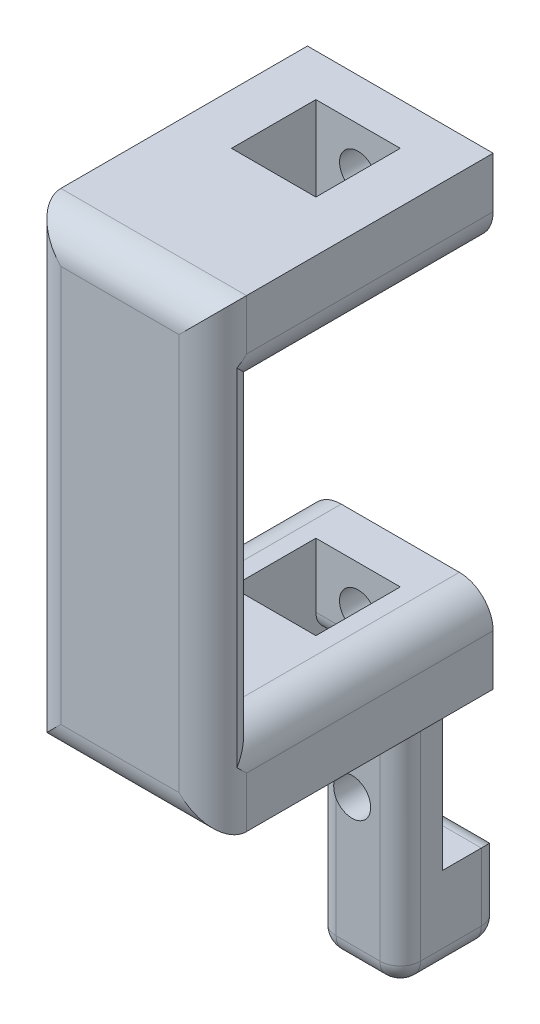
from build123d import *

# Parameters (mm, degrees)
SZKIC1_R                      = 1.100000000000001
DODANIE_WYCI_GNI_CIE1_DEPTH   = 2.5
SZKIC1_W                      = 10.999999999999996
SZKIC1_H                      = 5.000000000000001
SZKIC1_R_2                    = 1.1000003399999918
DODANIE_WYCI_GNI_CIE1_2_DEPTH = 2.5
SKETCH1_W                     = 2.9999999999999964
SKETCH1_H                     = 5
SKETCH1_W_2                   = 2.999999999999993
SKETCH1_H_2                   = 5.000000000000001
SKETCH1_W_3                   = 3
SKETCH1_H_3                   = 5.0000000000000036
BOSS_EXTRUDE1_DEPTH           = 5
SKETCH2_W                     = 11.000000000000002
SKETCH2_H                     = 5.0000000000000036
SKETCH2_W_2                   = 10.999999999999996
SKETCH2_H_2                   = 5.000000000000001
BOSS_EXTRUDE2_DEPTH           = 6.11
SKETCH3_W                     = 11
SKETCH3_H                     = 27.5
BOSS_EXTRUDE3_DEPTH           = 3
FILLET1_R                     = 2
FILLET4_R                     = 2
SKETCH4_W                     = 5.000000000000005
SKETCH4_H                     = 2.5000000000000284
BOSS_EXTRUDE4_DEPTH           = 16
SKETCH5_W                     = 5.000000000000005
SKETCH5_H                     = 5.204234406731111
BOSS_EXTRUDE5_DEPTH           = 3.5
CUT_EXTRUDE1_REACH            = 48.124
SKETCH6_R                     = 1.100000000000001
FILLET5_R                     = 1.2
FILLET6_R                     = 1.2
FILLET7_R                     = 1.2


# Some blends are built 0.0001 mm under size
with BuildPart() as part:
    # Szkic1 → Dodanie-wyciągnięcie1 (new body)
    with BuildSketch(Plane.XY.offset(158.8328846419772)):
        Polygon((-19.268421222013334, -17.474256580110417), (-8.268421222013332, -17.474256580110413), (-8.268421222013332, -22.474256580110417), (-19.268421222013334, -22.474256580110417), align=None)
        with Locations((-13.768421222013336, -19.974256580110417)):
            Circle(SZKIC1_R, mode=Mode.SUBTRACT)
    extrude(amount=DODANIE_WYCI_GNI_CIE1_DEPTH)



with BuildPart() as body_2:
    # Szkic1 → Dodanie-wyci_gni_cie1 2 (new body)
    with BuildSketch(Plane.XY.offset(158.8328846419772)):
        with Locations((-13.768421222013332, 2.5257434198895825)):
            Rectangle(SZKIC1_W, SZKIC1_H)
        with Locations((-13.768421222013332, 2.5257434198895856)):
            Circle(SZKIC1_R_2, mode=Mode.SUBTRACT)
    extrude(amount=DODANIE_WYCI_GNI_CIE1_2_DEPTH)


with BuildPart() as part_1:
    add(part.part)

    add(body_2.part)  # Boss-Extrude1 merges body 2
    # Sketch1 → Boss-Extrude1 (add)
    with BuildSketch(Plane.XY.offset(161.33288464197722)):
        with Locations((-17.768421222013338, -19.974256580110417)):
            Rectangle(SKETCH1_W, SKETCH1_H)
        with Locations((-17.768421222013334, 2.5257434198895825)):
            Rectangle(SKETCH1_W_2, SKETCH1_H_2)
        with Locations((-9.768421222013334, 2.5257434198895825)):
            Rectangle(SKETCH1_W_3, SKETCH1_H_2)
        with Locations((-9.768421222013332, -19.974256580110413)):
            Rectangle(SKETCH1_W_3, SKETCH1_H_3)
    extrude(amount=BOSS_EXTRUDE1_DEPTH)

    # Sketch2 → Boss-Extrude2 (add)
    with BuildSketch(Plane.XY.offset(166.33288464197722)):
        with Locations((-13.768421222013334, -19.974256580110413)):
            Rectangle(SKETCH2_W, SKETCH2_H)
        with Locations((-13.768421222013332, 2.5257434198895825)):
            Rectangle(SKETCH2_W_2, SKETCH2_H_2)
    extrude(amount=BOSS_EXTRUDE2_DEPTH)

    # Sketch3 → Boss-Extrude3 (add)
    with BuildSketch(Plane.XY.offset(172.4428846419772)):
        with Locations((-13.768421222013334, -8.724256580110417)):
            Rectangle(SKETCH3_W, SKETCH3_H)
    extrude(amount=BOSS_EXTRUDE3_DEPTH)

    # Fillet1
    fillet1_edges = [part_1.edges().sort_by_distance(p)[0] for p in [
        (-19.268421222013334, -8.724256580110417, 175.4428846419772),
        (-13.768421222013334, -22.474256580110417, 175.4428846419772),
        (-8.268421222013334, -8.724256580110417, 175.4428846419772),
        (-13.768421222013334, 5.025743419889583, 175.4428846419772),
    ]]
    fillet(fillet1_edges, radius=FILLET1_R)

    # Fillet4
    # the kernel refuses this fillet: 2 mm, written as the material it takes off along each edge
    with BuildSketch(Plane(origin=(-8.268421222013334, -17.474256580110413, 172.4428846419772), x_dir=(0, 0, 1), z_dir=(0, 1, 0))) as fillet4_piece_1:
        with BuildLine():
            CenterArc((FILLET4_R, -FILLET4_R), FILLET4_R, 90, 90)
            Line((0, -FILLET4_R), (0, 0))
            Line((0, 0), (FILLET4_R, 0))
        make_face()
    extrude(amount=17.499999999999996, mode=Mode.SUBTRACT)
    with BuildSketch(Plane(origin=(-19.268421222013334, 0.02574341988958206, 172.4428846419772), x_dir=(1.78e-15, 0, 1), z_dir=(0, -1, 0))) as fillet4_piece_2:
        with BuildLine():
            CenterArc((FILLET4_R, -FILLET4_R), FILLET4_R, 90.0000000000001, 89.9999999999999)
            Line((3.55e-15, -FILLET4_R), (0, 0))
            Line((0, 0), (FILLET4_R, 0))
        make_face()
    extrude(amount=17.499999999999996, mode=Mode.SUBTRACT)
    with BuildSketch(Plane(origin=(-8.268421222013334, 0.02574341988958231, 153.8328846419772), x_dir=(0, 1, 0), z_dir=(0, 0, 1)), Plane(origin=(-19.26842122201333, 0.02574341988958231, 172.44288464197723), x_dir=(0, 1, 0), z_dir=(0, 0, -1))) as fillet4_piece_3:
        with BuildLine():
            CenterArc((FILLET4_R, FILLET4_R), FILLET4_R, 180, 90)
            Line((-2.5e-16, FILLET4_R), (0, 0))
            Line((0, 0), (FILLET4_R, 0))
        make_face()
    extrude(amount=18.610000000000042, mode=Mode.SUBTRACT)
    with BuildSketch(Plane(origin=(-19.26842122201333, -17.474256580110417, 153.8328846419772), x_dir=(0, -1, 2.6e-16), z_dir=(0, 2.6e-16, 1))) as fillet4_piece_4:
        with BuildLine():
            CenterArc((FILLET4_R, FILLET4_R), FILLET4_R, 180, 90)
            Line((0, FILLET4_R), (0, 0))
            Line((0, 0), (FILLET4_R, 0))
        make_face()
    extrude(amount=18.610000000000042, mode=Mode.SUBTRACT)
    with BuildSketch(Plane(origin=(-8.268421222013332, -17.474256580110413, 172.44288464197723), x_dir=(-8.9e-16, -1, 0), z_dir=(0, 0, -1))) as fillet4_piece_5:
        with BuildLine():
            CenterArc((FILLET4_R, FILLET4_R), FILLET4_R, 180, 89.99999999999994)
            Line((1.78e-15, FILLET4_R), (0, 0))
            Line((0, 0), (FILLET4_R, 0))
        make_face()
    extrude(amount=18.610000000000042, mode=Mode.SUBTRACT)
    with BuildSketch(Plane(origin=(-8.268421222013334, -17.474256580110413, 177.44288464197723), x_dir=(0, -1, 0), z_dir=(0, 0, -1))) as fillet4_piece_6a_section:
        with BuildLine():
            CenterArc((FILLET4_R, FILLET4_R), FILLET4_R, 180.00000000000006, 89.99999999999994)
            Line((0, FILLET4_R), (0, 0))
            Line((0, 0), (FILLET4_R, 0))
        make_face()
    fillet4_piece_6a = extrude(amount=23.610000000000042, mode=Mode.PRIVATE)
    fillet4_piece_6a = split(fillet4_piece_6a, bisect_by=Plane(origin=(-8.721211450546983, -17.92704680864406, 172.4428846419772), z_dir=(0, 0, 1)), keep=Keep.TOP, mode=Mode.PRIVATE)
    with BuildSketch(Plane(origin=(-8.268421222013334, -22.474256580110413, 172.4428846419772), x_dir=(0, 0, 1), z_dir=(0, 1, 0))) as fillet4_piece_6b_section:
        with BuildLine():
            CenterArc((FILLET4_R, -FILLET4_R), FILLET4_R, 90, 90)
            Line((0, -FILLET4_R), (0, 0))
            Line((0, 0), (FILLET4_R, 0))
        make_face()
    fillet4_piece_6b = extrude(amount=22.499999999999996, mode=Mode.PRIVATE)
    fillet4_piece_6b = split(fillet4_piece_6b, bisect_by=Plane(origin=(-8.721211450546978, -17.474256580110413, 172.89567487051085), z_dir=(3.2e-16, -1, 0)), keep=Keep.TOP, mode=Mode.PRIVATE)
    fillet4_piece_6 = fillet4_piece_6a & fillet4_piece_6b
    add(fillet4_piece_6, mode=Mode.SUBTRACT)
    with BuildSketch(Plane(origin=(-8.268421222013334, -17.474256580110413, 172.4428846419772), x_dir=(0, 0, 1), z_dir=(0, 1, 0))) as fillet4_piece_7a_section:
        with BuildLine():
            CenterArc((FILLET4_R, -FILLET4_R), FILLET4_R, 90, 90)
            Line((0, -FILLET4_R), (0, 0))
            Line((0, 0), (FILLET4_R, 0))
        make_face()
    fillet4_piece_7a = extrude(amount=22.499999999999996, mode=Mode.PRIVATE)
    fillet4_piece_7a = split(fillet4_piece_7a, bisect_by=Plane(origin=(-8.721211450546976, 0.02574341988958231, 172.89567487051085), z_dir=(0, 1, 0)), keep=Keep.TOP, mode=Mode.PRIVATE)
    with BuildSketch(Plane(origin=(-8.268421222013334, 0.02574341988958231, 153.8328846419772), x_dir=(0, 1, 0), z_dir=(0, 0, 1))) as fillet4_piece_7b_section:
        with BuildLine():
            CenterArc((FILLET4_R, FILLET4_R), FILLET4_R, 180, 90)
            Line((-2.5e-16, FILLET4_R), (0, 0))
            Line((0, 0), (FILLET4_R, 0))
        make_face()
    fillet4_piece_7b = extrude(amount=23.610000000000042, mode=Mode.PRIVATE)
    fillet4_piece_7b = split(fillet4_piece_7b, bisect_by=Plane(origin=(-8.721211450546985, 0.4785336484232321, 172.4428846419772), z_dir=(0, 0, 1)), keep=Keep.TOP, mode=Mode.PRIVATE)
    fillet4_piece_7 = fillet4_piece_7a & fillet4_piece_7b
    add(fillet4_piece_7, mode=Mode.SUBTRACT)
    with BuildSketch(Plane(origin=(-19.26842122201333, 0.02574341988958206, 177.44288464197723), x_dir=(0, 1, 0), z_dir=(0, 0, -1))) as fillet4_piece_8a_section:
        with BuildLine():
            CenterArc((FILLET4_R, FILLET4_R), FILLET4_R, 180, 90)
            Line((0, FILLET4_R), (0, 0))
            Line((0, 0), (FILLET4_R, 0))
        make_face()
    fillet4_piece_8a = extrude(amount=23.610000000000042, mode=Mode.PRIVATE)
    fillet4_piece_8a = split(fillet4_piece_8a, bisect_by=Plane(origin=(-18.81563099347968, 0.4785336484232321, 172.4428846419772), z_dir=(0, 0, 1)), keep=Keep.TOP, mode=Mode.PRIVATE)
    with BuildSketch(Plane(origin=(-19.26842122201333, 5.025743419889582, 172.4428846419772), x_dir=(0, 0, 1), z_dir=(0, -1, 0))) as fillet4_piece_8b_section:
        with BuildLine():
            CenterArc((FILLET4_R, -FILLET4_R), FILLET4_R, 90, 90)
            Line((0, -FILLET4_R), (0, 0))
            Line((0, 0), (FILLET4_R, 0))
        make_face()
    fillet4_piece_8b = extrude(amount=22.499999999999996, mode=Mode.PRIVATE)
    fillet4_piece_8b = split(fillet4_piece_8b, bisect_by=Plane(origin=(-18.815630993479687, 0.02574341988958231, 172.89567487051087), z_dir=(0, 1, 0)), keep=Keep.TOP, mode=Mode.PRIVATE)
    fillet4_piece_8 = fillet4_piece_8a & fillet4_piece_8b
    add(fillet4_piece_8, mode=Mode.SUBTRACT)
    with BuildSketch(Plane(origin=(-19.268421222013334, 0.02574341988958206, 172.4428846419772), x_dir=(1.78e-15, 0, 1), z_dir=(0, -1, 0))) as fillet4_piece_9a_section:
        with BuildLine():
            CenterArc((FILLET4_R, -FILLET4_R), FILLET4_R, 90.0000000000001, 89.9999999999999)
            Line((3.55e-15, -FILLET4_R), (0, 0))
            Line((0, 0), (FILLET4_R, 0))
        make_face()
    fillet4_piece_9a = extrude(amount=22.499999999999996, mode=Mode.PRIVATE)
    fillet4_piece_9a = split(fillet4_piece_9a, bisect_by=Plane(origin=(-18.815630993479687, -17.474256580110417, 172.89567487051082), z_dir=(3.2e-16, -1, 0)), keep=Keep.TOP, mode=Mode.PRIVATE)
    with BuildSketch(Plane(origin=(-19.26842122201333, -17.474256580110417, 153.8328846419772), x_dir=(0, -1, 2.6e-16), z_dir=(0, 2.6e-16, 1))) as fillet4_piece_9b_section:
        with BuildLine():
            CenterArc((FILLET4_R, FILLET4_R), FILLET4_R, 180, 90)
            Line((0, FILLET4_R), (0, 0))
            Line((0, 0), (FILLET4_R, 0))
        make_face()
    fillet4_piece_9b = extrude(amount=23.610000000000042, mode=Mode.PRIVATE)
    fillet4_piece_9b = split(fillet4_piece_9b, bisect_by=Plane(origin=(-18.815630993479676, -17.927046808644057, 172.4428846419772), z_dir=(0, 0, 1)), keep=Keep.TOP, mode=Mode.PRIVATE)
    fillet4_piece_9 = fillet4_piece_9a & fillet4_piece_9b
    add(fillet4_piece_9, mode=Mode.SUBTRACT)

    # Sketch4 → Boss-Extrude4 (add)
    with BuildSketch(Plane.XZ.offset(22.474256580110417)):
        with Locations((-13.768421222013334, 160.08288464197722)):
            Rectangle(SKETCH4_W, SKETCH4_H)
    extrude(amount=BOSS_EXTRUDE4_DEPTH)

    # Sketch5 → Boss-Extrude5 (add)
    with BuildSketch(Plane(origin=(0, 0, 158.8328846419772), x_dir=(-1, 0, 0), z_dir=(0, 0, -1))):
        with Locations((13.768421222013334, -35.872139376744855)):
            Rectangle(SKETCH5_W, SKETCH5_H)
    extrude(amount=BOSS_EXTRUDE5_DEPTH)

    # Sketch6 → Cut-Extrude1 (cut, up to next)
    with BuildSketch(Plane(origin=(0, 0, 158.8328846419772), x_dir=(-1, 0, 0), z_dir=(0, 0, -1)), mode=Mode.PRIVATE) as cut_extrude1_sk1:
        with Locations((14.12355315691837, -29.672298155784087)):
            Circle(SKETCH6_R)
    cut_extrude1_tool1 = extrude(cut_extrude1_sk1.sketch, amount=-CUT_EXTRUDE1_REACH, mode=Mode.PRIVATE) & part_1.part
    add(cut_extrude1_tool1.solids().sort_by_distance((-14.123553, -29.672298, 158.832885))[0], mode=Mode.SUBTRACT)

    # Fillet5
    fillet5_edges = [part_1.edges().sort_by_distance(p)[0] for p in [
        (-11.268421222013332, -35.872139376744855, 155.3328846419772),
        (-13.768421222013334, -38.47425658011041, 155.3328846419772),
        (-16.268421222013338, -35.872139376744855, 155.3328846419772),
        (-13.768421222013334, -33.2700221733793, 155.3328846419772),
    ]]
    fillet(fillet5_edges, radius=FILLET5_R)

    # Fillet6
    # the kernel refuses this fillet: 1.2 mm, written as the material it takes off along each edge
    with BuildSketch(Plane(origin=(-12.468421222013331, -37.27425658011042, 156.53288464197718), x_dir=(1, 0, 0), z_dir=(0, -1, 0))) as fillet6_piece_1_section:
        Polygon((0, 0), (FILLET6_R * 1.02, 0), (FILLET6_R * 1.02, -FILLET6_R * 1.02), (0, -FILLET6_R * 1.02), align=None)
    fillet6_piece_1 = extrude(amount=FILLET6_R * 1.02, mode=Mode.PRIVATE)
    fillet6_piece_1 = fillet6_piece_1 - Plane(origin=(-12.468421222013331, -37.27425658011042, 156.53288464197718), x_dir=(-0.7071067811865475, 0, 0.7071067811865475), z_dir=(0, -1, 0)) * Sphere(FILLET6_R, mode=Mode.PRIVATE)
    add(fillet6_piece_1, mode=Mode.SUBTRACT)
    with BuildSketch(Plane(origin=(-15.068421222013338, -37.27425658011042, 156.53288464197718), x_dir=(0, -1, 0), z_dir=(-1, 0, 0))) as fillet6_piece_2_section:
        Polygon((0, 0), (FILLET6_R * 1.02, 0), (FILLET6_R * 1.02, -FILLET6_R * 1.02), (0, -FILLET6_R * 1.02), align=None)
    fillet6_piece_2 = extrude(amount=FILLET6_R * 1.02, mode=Mode.PRIVATE)
    fillet6_piece_2 = fillet6_piece_2 - Plane(origin=(-15.068421222013338, -37.27425658011042, 156.53288464197718), x_dir=(0, 0.7071067811865475, 0.7071067811865475), z_dir=(-1, 0, 0)) * Sphere(FILLET6_R, mode=Mode.PRIVATE)
    add(fillet6_piece_2, mode=Mode.SUBTRACT)
    with BuildSketch(Plane(origin=(-12.468421222013331, -37.27425658011042, 160.13288464197723), x_dir=(0, -1, 0), z_dir=(1, 0, 0))) as fillet6_piece_3_section:
        Polygon((0, 0), (FILLET6_R * 1.02, 0), (FILLET6_R * 1.02, -FILLET6_R * 1.02), (0, -FILLET6_R * 1.02), align=None)
    fillet6_piece_3 = extrude(amount=FILLET6_R * 1.02, mode=Mode.PRIVATE)
    fillet6_piece_3 = fillet6_piece_3 - Plane(origin=(-12.468421222013331, -37.27425658011042, 160.13288464197723), x_dir=(0, 0.7071067811865475, -0.7071067811865475), z_dir=(1, 0, 0)) * Sphere(FILLET6_R, mode=Mode.PRIVATE)
    add(fillet6_piece_3, mode=Mode.SUBTRACT)
    with BuildSketch(Plane(origin=(-15.068421222013338, -37.27425658011042, 160.13288464197723), x_dir=(0, -1, 0), z_dir=(-1, 0, 0))) as fillet6_piece_4_section:
        Polygon((0, 0), (FILLET6_R * 1.02, 0), (FILLET6_R * 1.02, FILLET6_R * 1.02), (0, FILLET6_R * 1.02), align=None)
    fillet6_piece_4 = extrude(amount=FILLET6_R * 1.02, mode=Mode.PRIVATE)
    fillet6_piece_4 = fillet6_piece_4 - Plane(origin=(-15.068421222013338, -37.27425658011042, 160.13288464197723), x_dir=(0, 0.7071067811865475, -0.7071067811865475), z_dir=(-1, 0, 0)) * Sphere(FILLET6_R, mode=Mode.PRIVATE)
    add(fillet6_piece_4, mode=Mode.SUBTRACT)
    with BuildSketch(Plane(origin=(-11.268421222013332, -22.474256580110417, 161.33288464197722), x_dir=(-1, 0, -2.368e-14), z_dir=(0, -1, 0))) as fillet6_piece_5:
        with BuildLine():
            CenterArc((FILLET6_R, FILLET6_R), FILLET6_R, 180, 89.99999999999864)
            Line((2.842e-14, FILLET6_R), (0, 0))
            Line((0, 0), (FILLET6_R, 0))
        make_face()
    extrude(amount=14.8, mode=Mode.SUBTRACT)
    with BuildSketch(Plane(origin=(-16.268421222013338, -22.474256580110417, 161.33288464197722), x_dir=(0, 0, -1), z_dir=(0, -1, 0))) as fillet6_piece_6:
        with BuildLine():
            CenterArc((FILLET6_R, FILLET6_R), FILLET6_R, 180, 90)
            Line((0, FILLET6_R), (0, 0))
            Line((0, 0), (FILLET6_R, 0))
        make_face()
    extrude(amount=14.8, mode=Mode.SUBTRACT)
    with BuildSketch(Plane(origin=(-12.468421222013331, -38.47425658011042, 161.33288464197722), x_dir=(0, 0, -1), z_dir=(-1, 0, 0))) as fillet6_piece_7:
        with BuildLine():
            CenterArc((FILLET6_R, -FILLET6_R), FILLET6_R, 90, 90)
            Line((0, -FILLET6_R), (0, 0))
            Line((0, 0), (FILLET6_R, 0))
        make_face()
    extrude(amount=2.6000000000000068, mode=Mode.SUBTRACT)
    with BuildSketch(Plane(origin=(-16.268421222013338, -38.47425658011041, 156.53288464197718), x_dir=(0, 1, 1.18e-15), z_dir=(0, -1.18e-15, 1))) as fillet6_piece_8:
        with BuildLine():
            CenterArc((FILLET6_R, -FILLET6_R), FILLET6_R, 90, 90)
            Line((0, -FILLET6_R), (0, 0))
            Line((0, 0), (FILLET6_R, 0))
        make_face()
    extrude(amount=3.600000000000051, mode=Mode.SUBTRACT)
    with BuildSketch(Plane(origin=(-11.268421222013332, -38.47425658011042, 160.13288464197723), x_dir=(-1, 0, 0), z_dir=(0, 1.18e-15, -1))) as fillet6_piece_9:
        with BuildLine():
            CenterArc((FILLET6_R, FILLET6_R), FILLET6_R, 180, 90)
            Line((0, FILLET6_R), (0, 0))
            Line((0, 0), (FILLET6_R, 0))
        make_face()
    extrude(amount=3.600000000000051, mode=Mode.SUBTRACT)

    # Fillet7
    fillet7_edges = [part_1.edges().sort_by_distance(p)[0] for p in [
        (-15.668421222013, -22.47425658011, 161.332884641977),
        (-11.868421222013, -22.47425658011, 161.332884641977),
    ]]
    fillet(fillet7_edges, radius=FILLET7_R - 0.0001)  # a hair under: the kernel refuses the full size


solid = part_1.part
